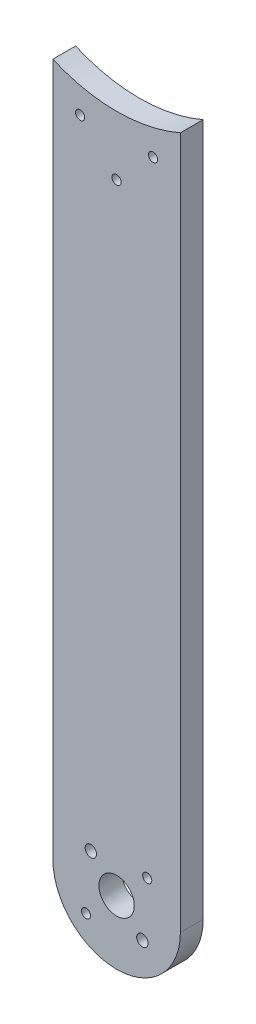
from build123d import *

# Parameters (mm, degrees)
SKETCH1_R           = 1
SKETCH1_R_2         = 1.25
BOSS_EXTRUDE1_DEPTH = 5
CUT_EXTRUDE1_REACH  = 154.72
SKETCH2_R           = 3.875


with BuildPart() as part:
    # Sketch1 → Boss-Extrude1 (new body)
    with BuildSketch(Plane.XY):
        with BuildLine():
            Line((-14, 0), (-14, 151.995176795))
            ThreePointArc((-14, 151.995176795), (0, 149.07320666), (14, 151.995176795))
            Line((14, 151.995176795), (14, 0))
            ThreePointArc((14, 0), (0, -14), (-14, 0))
        make_face()
        with Locations((-8, 144.371191598)):
            Circle(SKETCH1_R, mode=Mode.SUBTRACT)
        with Locations((5.656854249, -5.656854249)):
            Circle(SKETCH1_R_2, mode=Mode.SUBTRACT)
        with Locations((-6.717514421, -6.717514421)):
            Circle(SKETCH1_R, mode=Mode.SUBTRACT)
        with Locations((6.717514421, 6.717514421)):
            Circle(SKETCH1_R, mode=Mode.SUBTRACT)
        with Locations((-5.656854249, 5.656854249)):
            Circle(SKETCH1_R_2, mode=Mode.SUBTRACT)
        with Locations((8, 144.371191598)):
            Circle(SKETCH1_R, mode=Mode.SUBTRACT)
        with Locations((0, 136.07320666)):
            Circle(SKETCH1_R, mode=Mode.SUBTRACT)
    extrude(amount=BOSS_EXTRUDE1_DEPTH)

    # Sketch2 → Cut-Extrude1 (cut, up to next)
    with BuildSketch(Plane.XY.offset(5), mode=Mode.PRIVATE) as cut_extrude1_sk1:
        Circle(SKETCH2_R)
    cut_extrude1_tool1 = extrude(cut_extrude1_sk1.sketch, amount=-CUT_EXTRUDE1_REACH, mode=Mode.PRIVATE) & part.part
    add(cut_extrude1_tool1.solids().sort_by_distance((0, 0, 5))[0], mode=Mode.SUBTRACT)


solid = part.part
